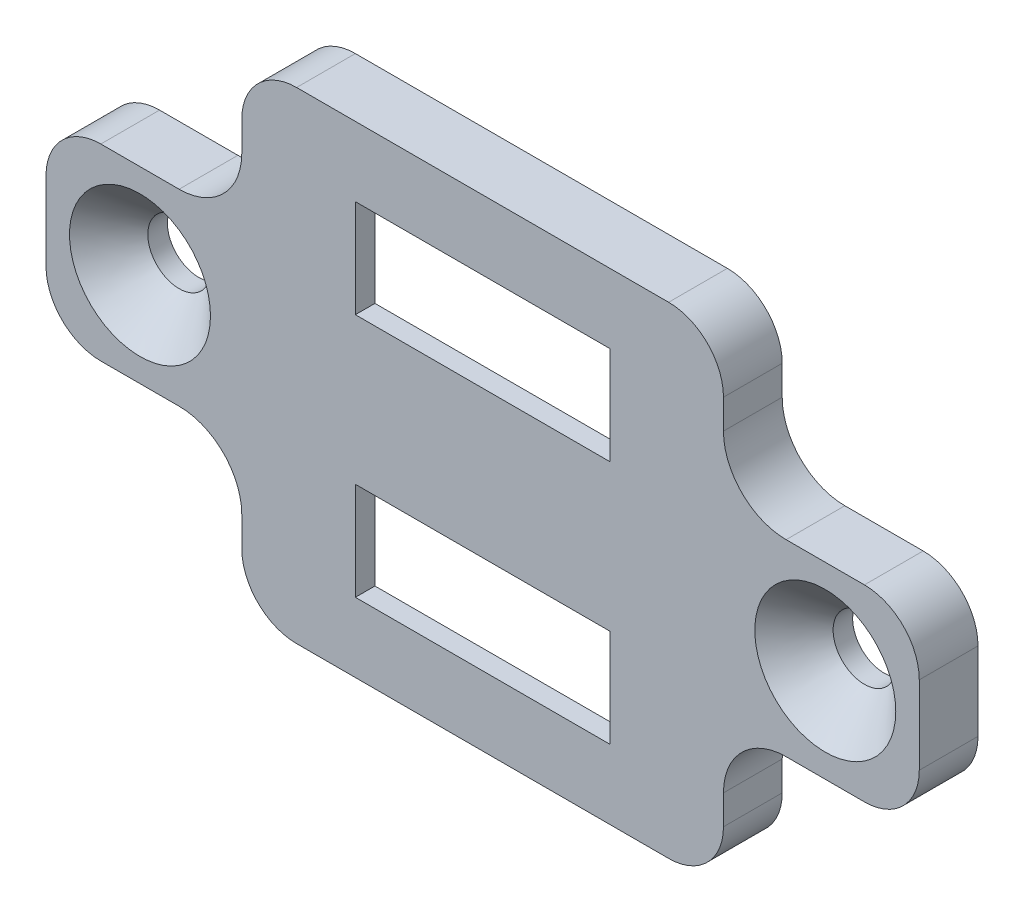
from build123d import *

# Parameters (mm, degrees)
ESQUISSE1_R             = 1.6
BOSS_EXTRU_1_DEPTH      = 3
ENL_V_MAT_EXTRU_1_DEPTH = 2
ESQUISSE4_W             = 13
ESQUISSE4_H             = 5
ENL_V_MAT_EXTRU_2_DEPTH = 26.545645421
CHANFREIN1_SIZE         = 2


with BuildPart() as part:
    # Esquisse1 → Boss.-Extru.1 (new body)
    with BuildSketch(Plane.XY):
        with BuildLine():
            Line((-9.5, 12.3), (9.5, 12.3))
            ThreePointArc((9.5, 12.3), (11.479898987, 11.479898987), (12.3, 9.5))
            Line((12.3, 9.5), (12.3, 8))
            ThreePointArc((12.3, 8), (13.2372583, 5.7372583), (15.5, 4.8))
            Line((15.5, 4.8), (19.5, 4.8))
            ThreePointArc((19.5, 4.8), (21.479898987, 3.979898987), (22.3, 2))
            Line((22.3, 2), (22.3, -2))
            ThreePointArc((22.3, -2), (21.479898987, -3.979898987), (19.5, -4.8))
            Line((19.5, -4.8), (15.5, -4.8))
            ThreePointArc((15.5, -4.8), (13.2372583, -5.7372583), (12.3, -8))
            Line((12.3, -8), (12.3, -9.5))
            ThreePointArc((12.3, -9.5), (11.479898987, -11.479898987), (9.5, -12.3))
            Line((9.5, -12.3), (-9.5, -12.3))
            ThreePointArc((-9.5, -12.3), (-11.479898987, -11.479898987), (-12.3, -9.5))
            Line((-12.3, -9.5), (-12.3, -8))
            ThreePointArc((-12.3, -8), (-13.2372583, -5.7372583), (-15.5, -4.8))
            Line((-15.5, -4.8), (-19.5, -4.8))
            ThreePointArc((-19.5, -4.8), (-21.479898987, -3.979898987), (-22.3, -2))
            Line((-22.3, -2), (-22.3, 2))
            ThreePointArc((-22.3, 2), (-21.479898987, 3.979898987), (-19.5, 4.8))
            Line((-19.5, 4.8), (-15.5, 4.8))
            ThreePointArc((-15.5, 4.8), (-13.2372583, 5.7372583), (-12.3, 8))
            Line((-12.3, 8), (-12.3, 9.5))
            ThreePointArc((-12.3, 9.5), (-11.479898987, 11.479898987), (-9.5, 12.3))
        make_face()
        with Locations((-17.5, 0)):
            Circle(ESQUISSE1_R, mode=Mode.SUBTRACT)
        with Locations((17.5, 0)):
            Circle(ESQUISSE1_R, mode=Mode.SUBTRACT)
    extrude(amount=BOSS_EXTRU_1_DEPTH)

    # Esquisse2 → Enlèv. mat.-Extru.1 (cut)
    with BuildSketch(Plane(origin=(0, 0, 0), x_dir=(-1, 0, 0), z_dir=(0, 0, -1))):
        with BuildLine():
            Line((-8.75, 11.75), (8.75, 11.75))
            ThreePointArc((8.75, 11.75), (10.871320344, 10.871320344), (11.75, 8.75))
            Line((11.75, 8.75), (11.75, -8.75))
            ThreePointArc((11.75, -8.75), (10.871320344, -10.871320344), (8.75, -11.75))
            Line((8.75, -11.75), (-8.75, -11.75))
            ThreePointArc((-8.75, -11.75), (-10.871320344, -10.871320344), (-11.75, -8.75))
            Line((-11.75, -8.75), (-11.75, 8.75))
            ThreePointArc((-11.75, 8.75), (-10.871320344, 10.871320344), (-8.75, 11.75))
        make_face()
    extrude(amount=-ENL_V_MAT_EXTRU_1_DEPTH, mode=Mode.SUBTRACT)

    # Esquisse4 → Enlèv. mat.-Extru.2 (cut, through all)
    with BuildSketch(Plane(origin=(0, 0, 2), x_dir=(-1, 0, 0), z_dir=(0, 0, -1))):
        with Locations((0, 6.25)):
            Rectangle(ESQUISSE4_W, ESQUISSE4_H)
        with Locations((0, -6.25)):
            Rectangle(ESQUISSE4_W, ESQUISSE4_H)
    extrude(amount=-ENL_V_MAT_EXTRU_2_DEPTH, mode=Mode.SUBTRACT)

    # Chanfrein1
    chanfrein1_edges = [part.edges().sort_by_distance(p)[0] for p in [
        (15.9, 0, 3),
        (-19.1, 0, 3),
    ]]
    chamfer(chanfrein1_edges, length=CHANFREIN1_SIZE)


solid = part.part
